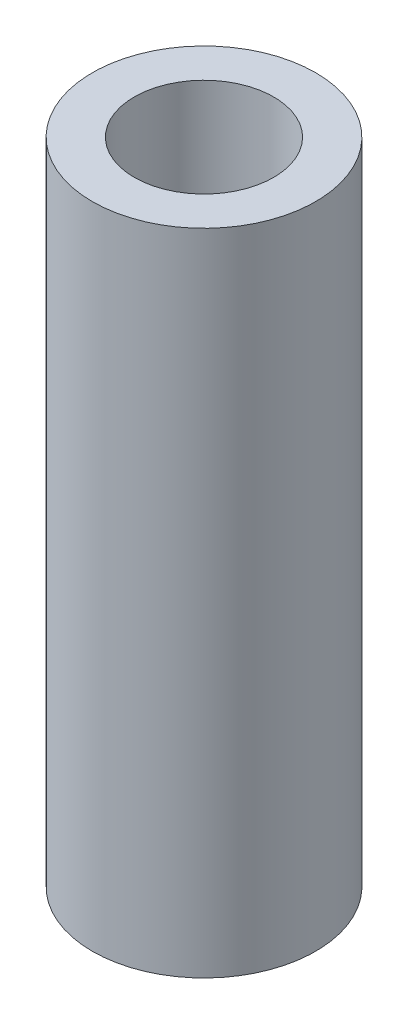
from build123d import *

# Parameters (mm, degrees)
SKETCH1_R           = 15
BOSS_EXTRUDE1_DEPTH = 87.217191239
SKETCH2_R           = 9.36669764
CUT_EXTRUDE1_DEPTH  = 90.759893313


with BuildPart() as part:
    # Sketch1 → Boss-Extrude1 (new body)
    with BuildSketch(Plane(origin=(0, 0, 0), x_dir=(1, 0, 0), z_dir=(0, 1, 0))):
        Circle(SKETCH1_R)
    extrude(amount=BOSS_EXTRUDE1_DEPTH)

    # Sketch2 → Cut-Extrude1 (cut, through all)
    with BuildSketch(Plane(origin=(0, 0, 0), x_dir=(1, 0, 0), z_dir=(0, 1, 0))):
        Circle(SKETCH2_R)
    extrude(amount=CUT_EXTRUDE1_DEPTH, mode=Mode.SUBTRACT)


solid = part.part
